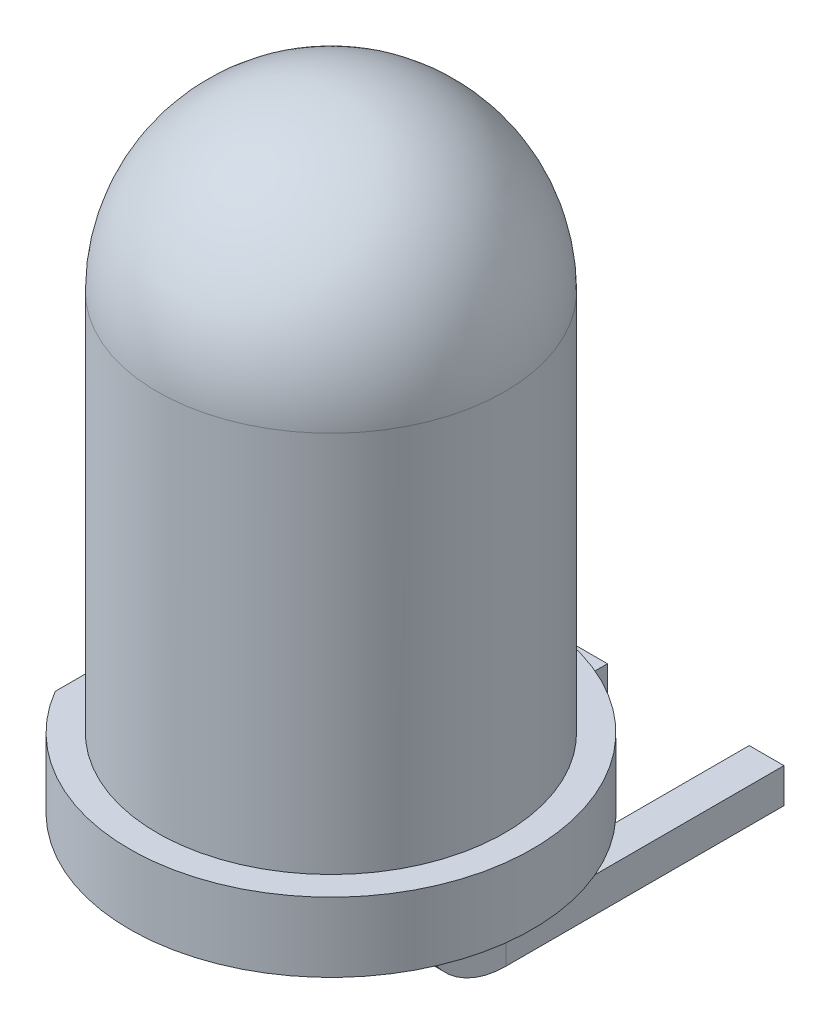
from build123d import *

# Parameters (mm, degrees)
SKETCH2_W          = 0.4
SKETCH2_H          = 2.939387692
CUT_EXTRUDE1_DEPTH = 10.890399385
SKETCH3_W          = 0.5
SKETCH3_H          = 0.5


with BuildPart() as part:
    # Sketch1 → Revolve1 (revolve)
    with BuildSketch(Plane(origin=(0, 0, 0), x_dir=(1, 0, 0), z_dir=(0, 0, -1))):
        with BuildLine():
            Line((0, 0), (0, -9))
            ThreePointArc((0, -9), (1.767766953, -8.267766953), (2.5, -6.5))
            Line((2.5, -6.5), (2.5, -1))
            Line((2.5, -1), (2.9, -1))
            Line((2.9, -1), (2.9, 0))
            Line((2.9, 0), (0, 0))
        make_face()
    revolve(axis=Axis((0, 0, 0), (0, 1, 0)))

    # Sketch2 → Cut-Extrude1 (cut, through all)
    with BuildSketch(Plane(origin=(0, 0, 0), x_dir=(-1, 0, 0), z_dir=(0, -1, 0))):
        with Locations((2.7, 0)):
            Rectangle(SKETCH2_W, SKETCH2_H)
    extrude(amount=-CUT_EXTRUDE1_DEPTH, mode=Mode.SUBTRACT)

    # Sweep1: sweep along a path in Sketch4
    with BuildLine(Plane(origin=(-1.27, 0, 0), x_dir=(0, 0, -1), z_dir=(1, 0, 0))) as sweep1_path:
        Line((0, 0), (0, -0.4))
        ThreePointArc((0, -0.4), (0.292893219, -1.107106781), (1, -1.4))
        Line((1, -1.4), (5, -1.4))
    # Sketch3 → Sweep1 (sweep)
    with BuildSketch(Plane(origin=(0, 0, 0), x_dir=(-1, 0, 0), z_dir=(0, -1, 0))):
        with Locations((-1.27, 0)):
            Rectangle(SKETCH3_W, SKETCH3_H)
        with Locations((1.27, 0)):
            Rectangle(SKETCH3_W, SKETCH3_H)
    sweep(path=sweep1_path.line)


solid = part.part
